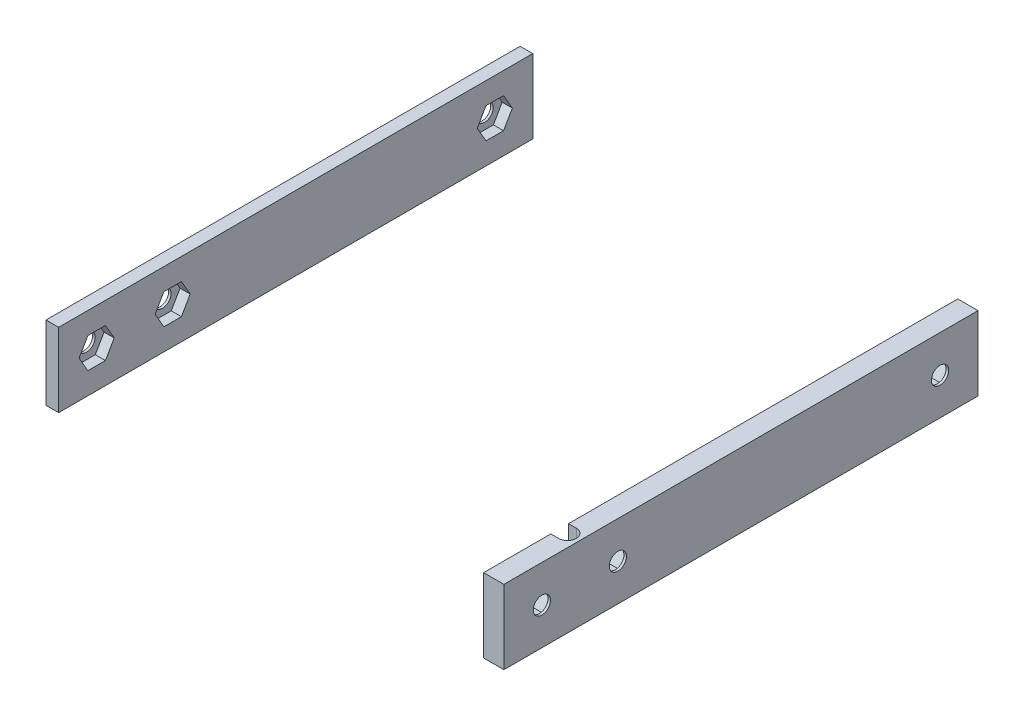
from build123d import *

# Parameters (mm, degrees)
SKETCH1_W                     = 2.5
SKETCH1_H                     = 93.6
BOSS_EXTRUDE1_DEPTH           = 14.6
SKETCH1_W_2                   = 4
BOSS_EXTRUDE1_2_DEPTH         = 14.6
CUT_EXTRUDE1_DEPTH            = 67.681631654
SKETCH7_W                     = 1.7
SKETCH7_H                     = 90.4
M3_CLEARANCE_HOLE1_AT_2_COUNT = 2
M3_CLEARANCE_HOLE1_AT_2_PITCH = 15
M3_CLEARANCE_HOLE1_AT_3_COUNT = 2
M3_CLEARANCE_HOLE1_AT_3_PITCH = 63.6
CUT_EXTRUDE2_DEPTH            = 3.5


with BuildPart() as part:
    # Sketch1 → Boss-Extrude1 (new body)
    with BuildSketch(Plane(origin=(0, 0, 0), x_dir=(1, 0, 0), z_dir=(0, 1, 0))):
        with Locations((-43.95, 0)):
            Rectangle(SKETCH1_W, SKETCH1_H)
    extrude(amount=BOSS_EXTRUDE1_DEPTH)


with BuildPart() as body_2:
    # Sketch1 → Boss-Extrude1 2 (new body)
    with BuildSketch(Plane(origin=(0, 0, 0), x_dir=(1, 0, 0), z_dir=(0, 1, 0))):
        with Locations((43.2, 0)):
            Rectangle(SKETCH1_W_2, SKETCH1_H)
    extrude(amount=BOSS_EXTRUDE1_2_DEPTH)

    # Sketch4 → Cut-Extrude1 (cut, through all)
    with BuildSketch(Plane(origin=(0, 14.6, 0), x_dir=(1, 0, 0), z_dir=(0, 1, 0))):
        with BuildLine():
            Line((41.2, -33.55), (42.75, -33.55))
            ThreePointArc((42.75, -33.55), (44.5, -31.8), (42.75, -30.05))
            Line((42.75, -30.05), (41.2, -30.05))
            Line((41.2, -30.05), (41.2, -33.55))
        make_face()
    extrude(amount=-CUT_EXTRUDE1_DEPTH, mode=Mode.SUBTRACT)


with BuildPart() as m3_clearance_hole1_tool:
    # Sketch7 → M3 Clearance Hole1 (revolve)
    with BuildSketch(Plane(origin=(45.2, 7.3, 24.3), x_dir=(0, 0, -1), z_dir=(0, 1, 0))):
        with Locations((0.85, 45.2)):
            Rectangle(SKETCH7_W, SKETCH7_H)
    m3_clearance_hole1 = revolve(axis=Axis((51.55, 7.3, 24.3), (-1, 0, 0)))


with BuildPart() as part_1:
    add(part.part)

    # M3 Clearance Hole1: cut by m3_clearance_hole1_tool
    add(m3_clearance_hole1_tool.part, mode=Mode.SUBTRACT)


with BuildPart() as body_2_1:
    add(body_2.part)

    # M3 Clearance Hole1: cut by m3_clearance_hole1_tool
    add(m3_clearance_hole1_tool.part, mode=Mode.SUBTRACT)


with BuildPart() as m3_clearance_hole1_at_2_tool:
    # M3 Clearance Hole1 at 2: M3 Clearance Hole1 ×2
    with Locations(*[(0, 0, i * M3_CLEARANCE_HOLE1_AT_2_PITCH) for i in range(1, M3_CLEARANCE_HOLE1_AT_2_COUNT)]):
        add(m3_clearance_hole1)


with BuildPart() as part_2:
    add(part_1.part)

    # M3 Clearance Hole1 at 2: cut by m3_clearance_hole1_at_2_tool
    add(m3_clearance_hole1_at_2_tool.part, mode=Mode.SUBTRACT)


with BuildPart() as body_2_2:
    add(body_2_1.part)

    # M3 Clearance Hole1 at 2: cut by m3_clearance_hole1_at_2_tool
    add(m3_clearance_hole1_at_2_tool.part, mode=Mode.SUBTRACT)


with BuildPart() as m3_clearance_hole1_at_3_tool:
    # M3 Clearance Hole1 at 3: M3 Clearance Hole1 ×2
    with Locations(*[(0, 0, -i * M3_CLEARANCE_HOLE1_AT_3_PITCH) for i in range(1, M3_CLEARANCE_HOLE1_AT_3_COUNT)]):
        add(m3_clearance_hole1)


with BuildPart() as part_3:
    add(part_2.part)

    # M3 Clearance Hole1 at 3: cut by m3_clearance_hole1_at_3_tool
    add(m3_clearance_hole1_at_3_tool.part, mode=Mode.SUBTRACT)


with BuildPart() as body_2_3:
    add(body_2_2.part)

    # M3 Clearance Hole1 at 3: cut by m3_clearance_hole1_at_3_tool
    add(m3_clearance_hole1_at_3_tool.part, mode=Mode.SUBTRACT)

    # Sketch8 → Cut-Extrude2 (cut)
    with BuildSketch(Plane.ZY.offset(-41.2)):
        Polygon((-35.835898385, 7.3), (-37.567949192, 10.3), (-41.032050808, 10.3), (-42.764101615, 7.3), (-41.032050808, 4.3), (-37.567949192, 4.3), align=None)
        Polygon((27.764101615, 7.3), (26.032050808, 10.3), (22.567949192, 10.3), (20.835898385, 7.3), (22.567949192, 4.3), (26.032050808, 4.3), align=None)
        Polygon((42.764101615, 7.3), (41.032050808, 10.3), (37.567949192, 10.3), (35.835898385, 7.3), (37.567949192, 4.3), (41.032050808, 4.3), align=None)
    cut_extrude2 = extrude(amount=-CUT_EXTRUDE2_DEPTH, mode=Mode.SUBTRACT)


with BuildPart() as part_4:
    add(part_3.part)

    # Mirror1: Cut-Extrude2 across plane
    add(cut_extrude2.mirror(Plane(origin=(0, 0, 0), x_dir=(0, 0, 1), z_dir=(1, 0, 0))), mode=Mode.SUBTRACT)


solid = Compound([body_2_3.part, part_4.part])
